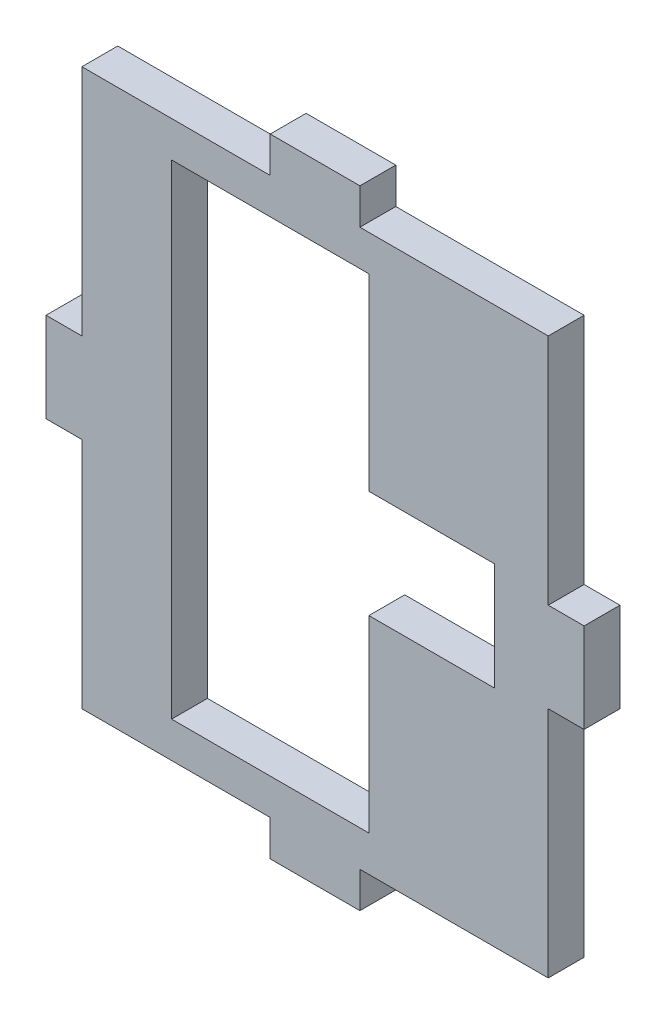
from build123d import *

# Parameters (mm, degrees)
SKETCH1_W           = 52
SKETCH1_H           = 62
BOSS_EXTRUDE1_DEPTH = 4
SKETCH2_W           = 4
SKETCH2_H           = 10
SKETCH2_W_2         = 10
SKETCH2_H_2         = 4
BOSS_EXTRUDE2_DEPTH = 4
SKETCH3_W           = 22
SKETCH3_H           = 54
CUT_EXTRUDE1_DEPTH  = 10
SKETCH4_W           = 18.193928836
SKETCH4_H           = 12
CUT_EXTRUDE2_DEPTH  = 10


with BuildPart() as part:
    # Sketch1 → Boss-Extrude1 (new body)
    with BuildSketch(Plane.XY):
        with Locations((26, 31)):
            Rectangle(SKETCH1_W, SKETCH1_H)
    extrude(amount=BOSS_EXTRUDE1_DEPTH)

    # Sketch2 → Boss-Extrude2 (add)
    with BuildSketch(Plane.XY.offset(4)):
        with Locations((-2, 31)):
            Rectangle(SKETCH2_W, SKETCH2_H)
        with Locations((54, 31)):
            Rectangle(SKETCH2_W, SKETCH2_H)
        with Locations((26, -2)):
            Rectangle(SKETCH2_W_2, SKETCH2_H_2)
        with Locations((26, 64)):
            Rectangle(SKETCH2_W_2, SKETCH2_H_2)
    extrude(amount=-BOSS_EXTRUDE2_DEPTH)

    # Sketch3 → Cut-Extrude1 (cut)
    with BuildSketch(Plane.XY.offset(4)):
        with Locations((21, 31)):
            Rectangle(SKETCH3_W, SKETCH3_H)
    extrude(amount=-CUT_EXTRUDE1_DEPTH, mode=Mode.SUBTRACT)

    # Sketch4 → Cut-Extrude2 (cut)
    with BuildSketch(Plane.XY.offset(4)):
        with Locations((36.903035582, 31)):
            Rectangle(SKETCH4_W, SKETCH4_H)
    extrude(amount=-CUT_EXTRUDE2_DEPTH, mode=Mode.SUBTRACT)


solid = part.part
